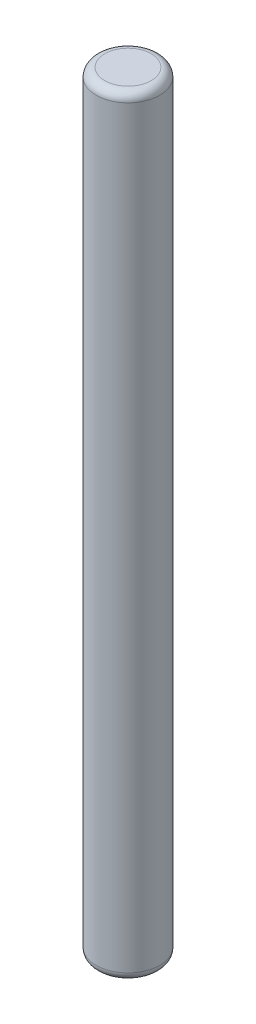
from build123d import *

# Parameters (mm, degrees)
SKETCH_1_R      = 0.375
EXTRUDE_1_DEPTH = 9.1
FILLET_1_R      = 0.1


with BuildPart() as part:
    # Эскиз1 → Бобышка-Вытянуть1 (new body)
    with BuildSketch(Plane(origin=(0, 0, 0), x_dir=(1, 0, 0), z_dir=(0, 1, 0))):
        Circle(SKETCH_1_R)
    extrude(amount=EXTRUDE_1_DEPTH)

    # Скругление1
    fillet_1_edges = [part.edges().sort_by_distance(p)[0] for p in [
        (-0.375, 0, 0),
        (-0.375, 9.1, 0),
    ]]
    fillet(fillet_1_edges, radius=FILLET_1_R)


solid = part.part
